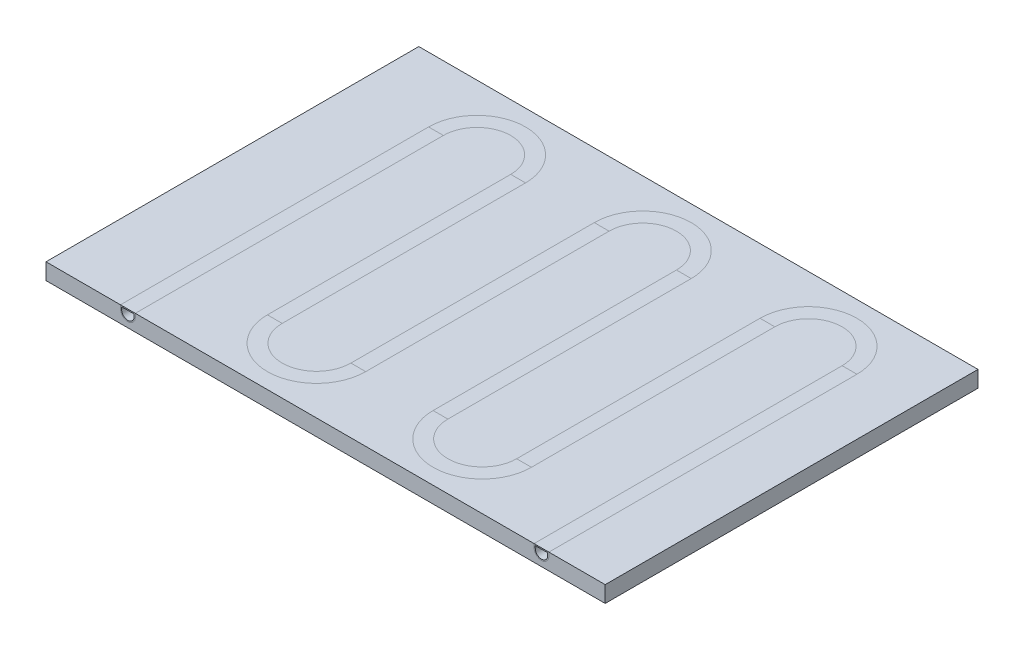
from build123d import *

# Parameters (mm, degrees)
SKETCH1_W           = 240
SKETCH1_H           = 160
BOSS_EXTRUDE1_DEPTH = 7


with BuildPart() as part:
    # Sketch1 → Boss-Extrude1 (new body)
    with BuildSketch(Plane(origin=(0, 0, 0), x_dir=(1, 0, 0), z_dir=(0, 1, 0))):
        Rectangle(SKETCH1_W, SKETCH1_H)
    extrude(amount=BOSS_EXTRUDE1_DEPTH)

    # Cut-Sweep1: sweep along a path in Sketch5
    with BuildLine(Plane(origin=(0, 7, 0), x_dir=(1, 0, 0), z_dir=(0, 1, 0))) as cut_sweep1_path:
        Line((-85, -80), (-85, 52.22))
        ThreePointArc((-85, 52.22), (-67.22, 70), (-49.44, 52.22))
        Line((-49.44, 52.22), (-49.44, -52.22))
        ThreePointArc((-49.44, -52.22), (-31.66, -70), (-13.88, -52.22))
        Line((-13.88, -52.22), (-13.88, 52.22))
        ThreePointArc((-13.88, 52.22), (3.9, 70), (21.68, 52.22))
        Line((21.68, 52.22), (21.68, -52.22))
        ThreePointArc((21.68, -52.22), (39.46, -70), (57.24, -52.22))
        Line((57.24, -52.22), (57.24, 52.22))
        ThreePointArc((57.24, 52.22), (75.02, 70), (92.8, 52.22))
        Line((92.8, 52.22), (92.8, -80))
    # Sketch6 → Cut-Sweep1 (sweep, cut)
    with BuildSketch(Plane.XY.offset(80)):
        with BuildLine():
            Line((-88.027530889, 5.475), (-88.027530889, 7))
            Line((-88.027530889, 7), (-81.677530889, 7))
            Line((-81.677530889, 7), (-81.677530889, 5.475))
            ThreePointArc((-81.677530889, 5.475), (-84.852530889, 2.3), (-88.027530889, 5.475))
        make_face()
    sweep(path=cut_sweep1_path.line, mode=Mode.SUBTRACT)


with BuildPart() as body_2:
    # Sweep1: sweep along a path in Sketch5<2>
    with BuildLine(Plane(origin=(0, 7, 0), x_dir=(1, 0, 0), z_dir=(0, 1, 0))) as sweep1_path:
        Line((-85, -80), (-85, 52.22))
        ThreePointArc((-85, 52.22), (-67.22, 70), (-49.44, 52.22))
        Line((-49.44, 52.22), (-49.44, -52.22))
        ThreePointArc((-49.44, -52.22), (-31.66, -70), (-13.88, -52.22))
        Line((-13.88, -52.22), (-13.88, 52.22))
        ThreePointArc((-13.88, 52.22), (3.9, 70), (21.68, 52.22))
        Line((21.68, 52.22), (21.68, -52.22))
        ThreePointArc((21.68, -52.22), (39.46, -70), (57.24, -52.22))
        Line((57.24, -52.22), (57.24, 52.22))
        ThreePointArc((57.24, 52.22), (75.02, 70), (92.8, 52.22))
        Line((92.8, 52.22), (92.8, -80))
    # Sketch7 → Sweep1 (sweep)
    with BuildSketch(Plane.XY.offset(80)):
        with BuildLine():
            Line((-88.027530889, 5.475), (-88.027530889, 7))
            Line((-88.027530889, 7), (-81.677530889, 7))
            Line((-81.677530889, 7), (-81.677530889, 5.475))
            ThreePointArc((-81.677530889, 5.475), (-84.852530889, 2.3), (-88.027530889, 5.475))
        make_face()
        with BuildLine():
            Line((-87.527530889, 5.475), (-87.527530889, 6.5))
            Line((-87.527530889, 6.5), (-82.177530889, 6.5))
            Line((-82.177530889, 6.5), (-82.177530889, 5.475))
            ThreePointArc((-82.177530889, 5.475), (-84.852530889, 2.8), (-87.527530889, 5.475))
        make_face(mode=Mode.SUBTRACT)
    sweep(path=sweep1_path.line)


solid = Compound([part.part, body_2.part])
